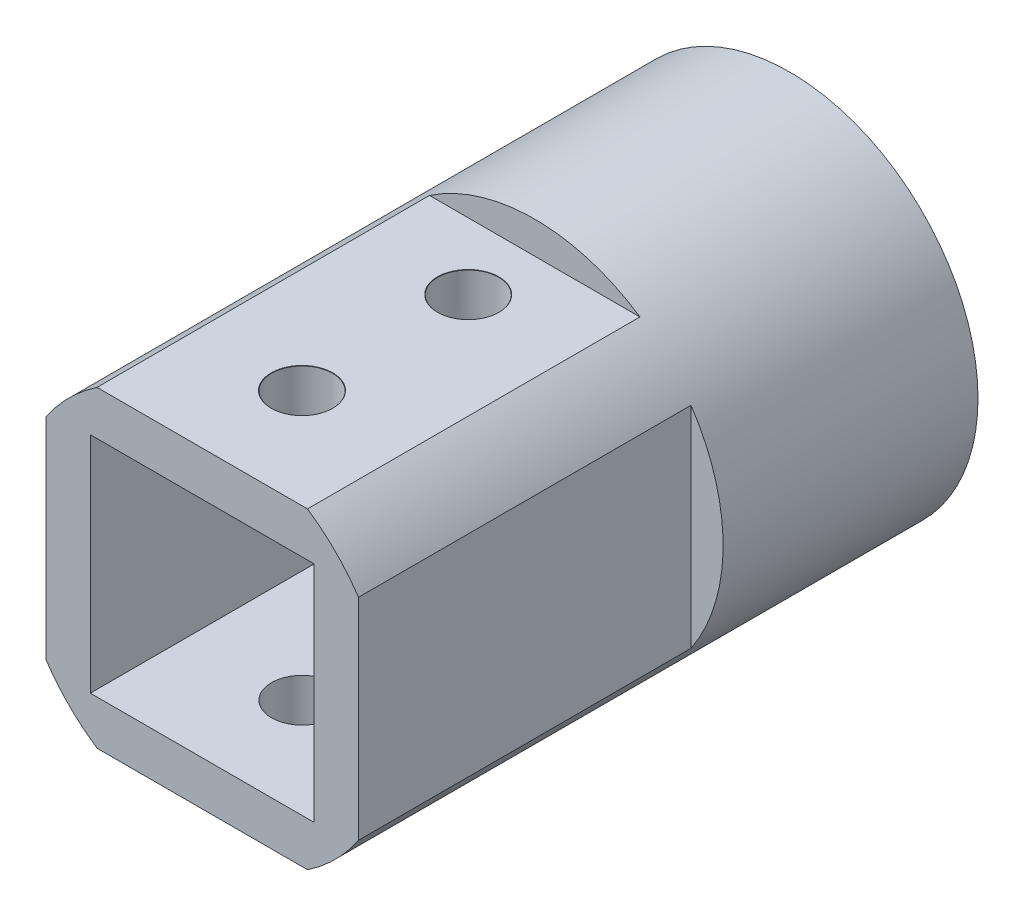
from build123d import *

# Parameters (mm, degrees)
SKETCH_1_R                     = 17
EXTRUDE_1_DEPTH                = 3
SKETCH_2_R                     = 17
SKETCH_2_R_2                   = 15
EXTRUDE_2_DEPTH                = 10
SKETCH_3_R                     = 5
CUT_EXTRUDE_1_DEPTH            = 27.038433133
SKETCH_4_R                     = 17
EXTRUDE_3_DEPTH                = 10
SKETCH_5_W                     = 20.2
SKETCH_5_H                     = 20.2
EXTRUDE_4_DEPTH                = 30
HOLE_WIZARD_M5_2_D             = 5.5
HOLE_WIZARD_M5_2_CSINK_D       = 5.55
HOLE_WIZARD_M5_2_CSINK_ANGLE   = 90
HOLE_WIZARD_M2_5_2_D           = 2.9
HOLE_WIZARD_M2_5_2_CSINK_D     = 2.95
HOLE_WIZARD_M2_5_2_CSINK_ANGLE = 90


with BuildPart() as part:
    # 草图1 → 凸台-拉伸1 (new body)
    with BuildSketch(Plane.XY):
        Circle(SKETCH_1_R)
    extrude(amount=EXTRUDE_1_DEPTH)

    # 草图2 → 凸台-拉伸2 (add)
    with BuildSketch(Plane.XY.offset(3)):
        Circle(SKETCH_2_R)
        Circle(SKETCH_2_R_2, mode=Mode.SUBTRACT)
    extrude(amount=EXTRUDE_2_DEPTH)

    # 草图3 → 切除-拉伸1 (cut, through all)
    with BuildSketch(Plane.XY.offset(3)):
        Circle(SKETCH_3_R)
    extrude(amount=-CUT_EXTRUDE_1_DEPTH, mode=Mode.SUBTRACT)

    # 草图4 → 凸台-拉伸3 (add)
    with BuildSketch(Plane.XY.offset(13)):
        Circle(SKETCH_4_R)
        Polygon((-4.443145751, 10.1), (4.443145751, 10.1), (10.1, 4.443145751), (10.1, -4.443145751), (4.443145751, -10.1), (-4.443145751, -10.1), (-10.1, -4.443145751), (-10.1, 4.443145751), align=None, mode=Mode.SUBTRACT)
    extrude(amount=EXTRUDE_3_DEPTH)

    # 草图5 → 凸台-拉伸4 (add)
    with BuildSketch(Plane.XY.offset(23)):
        with BuildLine():
            Line((9.49684158, 14.1), (-9.49684158, 14.1))
            ThreePointArc((-9.49684158, 14.1), (-12.02081528, 12.02081528), (-14.1, 9.49684158))
            Line((-14.1, 9.49684158), (-14.1, -9.496842588))
            ThreePointArc((-14.1, -9.496842588), (-12.020815678, -12.020815678), (-9.496842588, -14.1))
            Line((-9.496842588, -14.1), (9.49684158, -14.1))
            ThreePointArc((9.49684158, -14.1), (12.02081528, -12.02081528), (14.1, -9.49684158))
            Line((14.1, -9.49684158), (14.1, 9.49684158))
            ThreePointArc((14.1, 9.49684158), (12.02081528, 12.02081528), (9.49684158, 14.1))
        make_face()
        Rectangle(SKETCH_5_W, SKETCH_5_H, mode=Mode.SUBTRACT)
    extrude(amount=EXTRUDE_4_DEPTH)

    # M5 间隙孔2 (through all)
    with Locations(Plane(origin=(0, 14.1, 0), x_dir=(1, 0, 0), z_dir=(0, 1, 0))):
        with Locations((0, -29), (0, -44)):
            CounterSinkHole(HOLE_WIZARD_M5_2_D / 2, HOLE_WIZARD_M5_2_CSINK_D / 2, counter_sink_angle=HOLE_WIZARD_M5_2_CSINK_ANGLE)

    # M2.5 间隙孔2 (through all)
    with Locations(Plane.XY.offset(3)):
        with Locations((8, 0), (0, -8), (-8, 0), (0, 8)):
            CounterSinkHole(HOLE_WIZARD_M2_5_2_D / 2, HOLE_WIZARD_M2_5_2_CSINK_D / 2, counter_sink_angle=HOLE_WIZARD_M2_5_2_CSINK_ANGLE)


solid = part.part
